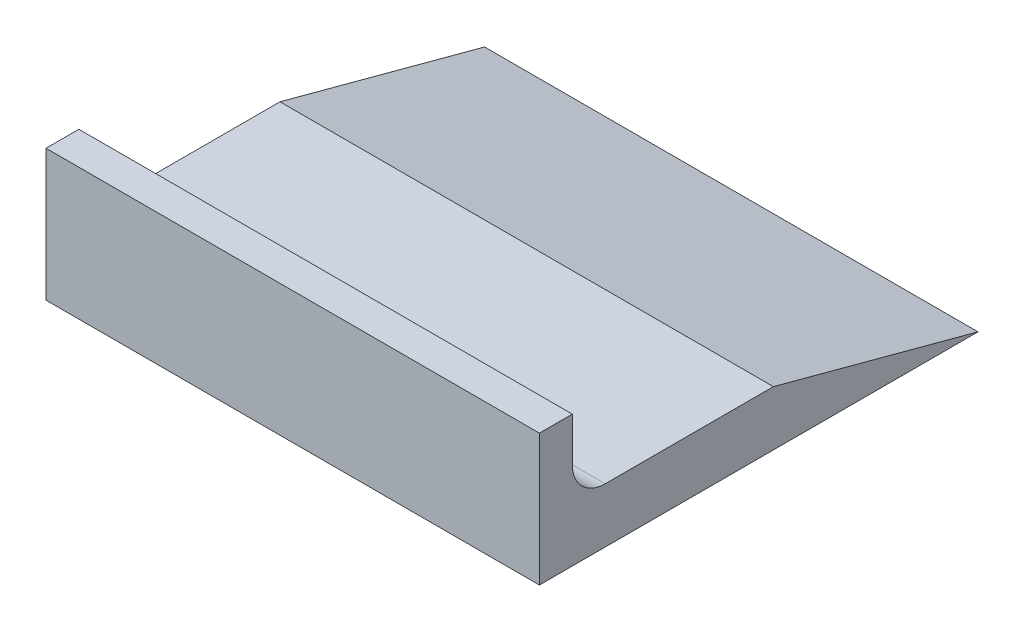
from build123d import *

# Parameters (mm, degrees)
SKETCH1_W           = 45
SKETCH1_H           = 40
BOSS_EXTRUDE1_DEPTH = 5
CHAMFER1_SIZE       = 5
CHAMFER1_SIZE_2     = 18.660254038
SKETCH2_W           = 45
SKETCH2_H           = 3
BOSS_EXTRUDE2_DEPTH = 7
FILLET1_R           = 3


with BuildPart() as part:
    # Sketch1 → Boss-Extrude1 (new body)
    with BuildSketch(Plane(origin=(0, 0, 0), x_dir=(1, 0, 0), z_dir=(0, 1, 0))):
        Rectangle(SKETCH1_W, SKETCH1_H)
    extrude(amount=BOSS_EXTRUDE1_DEPTH)

    # Chamfer1
    # the kernel refuses this chamfer: 18.660254038, 5 mm, written as the material it takes off along each edge
    with BuildSketch(Plane(origin=(-70.955484165, 5, -20), x_dir=(0, -0.9905000388259539, -0.13751244702129164), z_dir=(1, 0, 0))) as chamfer1_piece_1:
        Polygon((CHAMFER1_SIZE * 0.990500038826, -CHAMFER1_SIZE * 0.137512447021), (-CHAMFER1_SIZE_2 * 0.13751244702, -CHAMFER1_SIZE_2 * 0.990500038818), (0, 0), align=None)
    extrude(amount=141.910968331, mode=Mode.SUBTRACT)

    # Sketch2 → Boss-Extrude2 (add)
    with BuildSketch(Plane(origin=(0, 5, 0), x_dir=(1, 0, 0), z_dir=(0, 1, 0))):
        with Locations((0, -18.5)):
            Rectangle(SKETCH2_W, SKETCH2_H)
    extrude(amount=BOSS_EXTRUDE2_DEPTH)

    # Fillet1
    fillet1_edges = [part.edges().sort_by_distance(p)[0] for p in [
        (0, 5, 17),
    ]]
    fillet(fillet1_edges, radius=FILLET1_R)


solid = part.part
